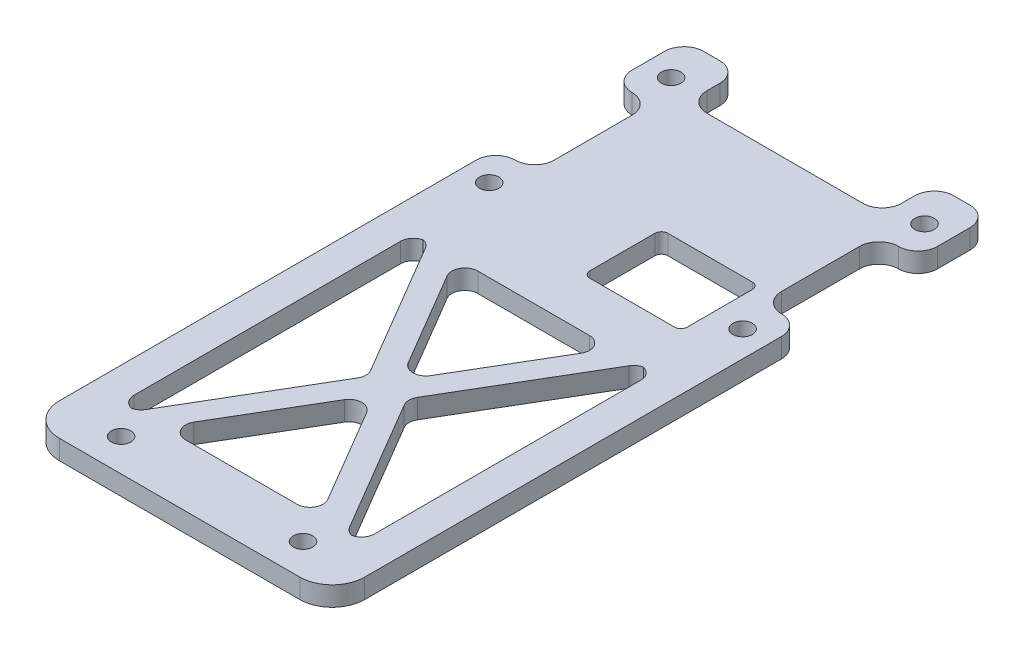
from build123d import *

# Parameters (mm, degrees)
SKETCH_1_W          = 47
SKETCH_1_H          = 40
SKETCH_1_R          = 1.5
SKETCH_1_W_2        = 30
SKETCH_1_H_2        = 12
SKETCH_1_H_3        = 66.16
SKETCH_1_W_3        = 15
EXTRUDE_1_DEPTH     = 3
SKETCH_4_R          = 1.5
SKETCH_4_W          = 47
SKETCH_4_H          = 5
CUT_EXTRUDE_2_DEPTH = 4
SKETCH_7_W          = 30
SKETCH_7_H          = 8
SKETCH_7_W_2        = 6
SKETCH_7_H_2        = 18
CUT_EXTRUDE_3_DEPTH = 10
FILLET_2_R          = 3
FILLET_3_R          = 1
CUT_EXTRUDE_4_DEPTH = 10
FILLET_4_R          = 2
FILLET_5_R          = 5
FILLET_6_R          = 3
FILLET_7_R          = 3


# Some blends are built 0.0001 mm under size
with BuildPart() as part:
    # 草图1 → 凸台-拉伸1 (new body)
    # profile 1 of 3: a face of its own
    with BuildSketch(Plane(origin=(0, 0, 0), x_dir=(1, 0, 0), z_dir=(0, 1, 0))):
        Rectangle(SKETCH_1_W, SKETCH_1_H)
        with Locations(Location((19.5, -14, 0), (0, 0, 270))):
            Circle(SKETCH_1_R, mode=Mode.SUBTRACT)
        with Locations(Location((19.5, 14, 0), (0, 0, 270))):
            Circle(SKETCH_1_R, mode=Mode.SUBTRACT)
        with Locations(Location((-19.5, -14, 0), (0, 0, 270))):
            Circle(SKETCH_1_R, mode=Mode.SUBTRACT)
        with Locations(Location((-19.5, 14, 0), (0, 0, 270))):
            Circle(SKETCH_1_R, mode=Mode.SUBTRACT)
        with Locations((0, -13)):
            Rectangle(SKETCH_1_W_2, SKETCH_1_H_2, mode=Mode.SUBTRACT)
    # profile 2 of 3: a face of its own
    with BuildSketch(Plane(origin=(0, 0, 0), x_dir=(1, 0, 0), z_dir=(0, 1, 0))):
        with Locations((0, -53.08)):
            Rectangle(SKETCH_1_W, SKETCH_1_H_3)
    # profile 3 of 3: a face of its own
    with BuildSketch(Plane(origin=(0, 0, 0), x_dir=(1, 0, 0), z_dir=(0, 1, 0))):
        with Locations((-7.5, -13)):
            Rectangle(SKETCH_1_W_3, SKETCH_1_H_2)
    extrude(amount=EXTRUDE_1_DEPTH)

    # 草图4 → 切除-拉伸2 (cut)
    with BuildSketch(Plane(origin=(0, 3, 0), x_dir=(1, 0, 0), z_dir=(0, 1, 0))):
        with Locations(Location((-14, -76.16, 0), (0, 0, 270))):
            Circle(SKETCH_4_R)
        with Locations(Location((14, -76.16, 0), (0, 0, 270))):
            Circle(SKETCH_4_R)
        with Locations((0, -83.66)):
            Rectangle(SKETCH_4_W, SKETCH_4_H)
    extrude(amount=-CUT_EXTRUDE_2_DEPTH, mode=Mode.SUBTRACT)

    # 草图7 → 切除-拉伸3 (cut)
    with BuildSketch(Plane(origin=(0, 3, 0), x_dir=(1, 0, 0), z_dir=(0, 1, 0))):
        with Locations((0, 16)):
            Rectangle(SKETCH_7_W, SKETCH_7_H)
        with Locations((20.5, 0)):
            Rectangle(SKETCH_7_W_2, SKETCH_7_H_2)
        with Locations((-20.5, 0)):
            Rectangle(SKETCH_7_W_2, SKETCH_7_H_2)
    extrude(amount=-CUT_EXTRUDE_3_DEPTH, mode=Mode.SUBTRACT)

    # 圆角2
    fillet_2_edges = [part.edges().sort_by_distance(p)[0] for p in [
        (-23.5, 1.5, -20),
        (23.5, 1.5, -20),
    ]]
    fillet(fillet_2_edges, radius=FILLET_2_R)

    # 圆角3
    fillet_3_edges = [part.edges().sort_by_distance(p)[0] for p in [
        (0, 1.5, 19),
        (15, 1.5, 19),
        (15, 1.5, 7),
        (0, 1.5, 7),
    ]]
    fillet(fillet_3_edges, radius=FILLET_3_R)

    # 草图9 → 切除-拉伸4 (cut)
    with BuildSketch(Plane(origin=(0, 3, 0), x_dir=(1, 0, 0), z_dir=(0, 1, 0))):
        Polygon((-3, -49.16), (-16.258928571, -26.66), (-18.5, -26.66), (-18.5, -71.66), (-16.258928571, -71.66), align=None)
        Polygon((0, -47.16), (12.080357143, -26.66), (-12.080357143, -26.66), align=None)
        Polygon((18.5, -26.66), (16.258928571, -26.66), (3, -49.16), (16.258928571, -71.66), (18.5, -71.66), align=None)
        Polygon((-12.080357143, -71.66), (12.080357143, -71.66), (0, -51.16), align=None)
    extrude(amount=-CUT_EXTRUDE_4_DEPTH, mode=Mode.SUBTRACT)

    # 圆角4
    # the kernel refuses this fillet: 2 mm, written as the material it adds along each edge
    with BuildSketch(Plane(origin=(16.258928571, 3, 71.66), x_dir=(-0.5076923076923154, 0, -0.8615384615384569), z_dir=(0, -1, 0)), Plane(origin=(16.258928571, 3, 26.66), x_dir=(1, 0, 0), z_dir=(0, -1, 0)), Plane(origin=(-16.258928571, 3, 71.66), x_dir=(-1, 0, 0), z_dir=(0, -1, 0)), Plane(origin=(-16.258928571, 3, 26.66), x_dir=(0.5076923076923154, 0, 0.8615384615384569), z_dir=(0, -1, 0))) as fillet_4_piece_1:
        with BuildLine():
            CenterArc((FILLET_4_R * 0.571428571429, FILLET_4_R), FILLET_4_R, 210.510237406, 59.489762594)
            Line((-FILLET_4_R * 0.29010989011, FILLET_4_R * 0.492307692308), (0, 0))
            Line((0, 0), (FILLET_4_R * 0.571428571429, 0))
        make_face()
    extrude(amount=3)
    with BuildSketch(Plane(origin=(3, 3, 49.16), x_dir=(0.5076923076923108, 0, -0.8615384615384596), z_dir=(0, -1, 0))) as fillet_4_piece_2:
        with BuildLine():
            CenterArc((FILLET_4_R * 0.589285714286, FILLET_4_R), FILLET_4_R, 208.979525188, 61.020474812)
            Line((-FILLET_4_R * 0.285507185123, FILLET_4_R * 0.51550295858), (0, 0))
            Line((0, 0), (FILLET_4_R * 0.589285714286, 0))
        make_face()
    extrude(amount=3)
    with BuildSketch(Plane(origin=(18.5, 3, 26.66), x_dir=(-1, 0, 0), z_dir=(0, -1, 0))) as fillet_4_piece_3:
        with BuildLine():
            CenterArc((FILLET_4_R, -FILLET_4_R), FILLET_4_R, 90, 90)
            Line((0, -FILLET_4_R), (0, 0))
            Line((0, 0), (FILLET_4_R, 0))
        make_face()
    extrude(amount=3)
    with BuildSketch(Plane(origin=(18.5, 3, 71.66), x_dir=(-1, 0, 0), z_dir=(0, -1, 0)), Plane(origin=(-18.5, 3, 71.66), x_dir=(0, 0, -1), z_dir=(0, -1, 0)), Plane(origin=(-18.5, 3, 26.66), x_dir=(1, 0, 0), z_dir=(0, -1, 0))) as fillet_4_piece_4:
        with BuildLine():
            CenterArc((FILLET_4_R, FILLET_4_R), FILLET_4_R, 180, 90)
            Line((0, FILLET_4_R), (0, 0))
            Line((0, 0), (FILLET_4_R, 0))
        make_face()
    extrude(amount=3)
    with BuildSketch(Plane(origin=(-12.080357143, 3, 26.66), x_dir=(0.5076923076923134, 0, 0.8615384615384581), z_dir=(0, -1, 0)), Plane(origin=(-12.080357143, 3, 71.66), x_dir=(1, 0, 0), z_dir=(0, -1, 0))) as fillet_4_piece_5:
        with BuildLine():
            CenterArc((FILLET_4_R * 1.75, -FILLET_4_R), FILLET_4_R, 90, 120.510237406)
            Line((FILLET_4_R * 0.888461538462, -FILLET_4_R * 1.50769230769), (0, 0))
            Line((0, 0), (FILLET_4_R * 1.75, 0))
        make_face()
    extrude(amount=3)
    with BuildSketch(Plane(origin=(12.080357143, 3, 26.66), x_dir=(-0.5076923076923134, 0, 0.8615384615384581), z_dir=(0, -1, 0)), Plane(origin=(12.080357143, 3, 71.66), x_dir=(-1, 0, 0), z_dir=(0, -1, 0))) as fillet_4_piece_6:
        with BuildLine():
            CenterArc((FILLET_4_R * 1.75, FILLET_4_R), FILLET_4_R, 149.489762594, 120.510237406)
            Line((FILLET_4_R * 0.888461538462, FILLET_4_R * 1.50769230769), (0, 0))
            Line((0, 0), (FILLET_4_R * 1.75, 0))
        make_face()
    extrude(amount=3)
    with BuildSketch(Plane(origin=(0, 3, 47.16), x_dir=(-0.5076923076923119, 0, -0.8615384615384591), z_dir=(0, -1, 0)), Plane(origin=(0, 3, 51.16), x_dir=(0.5076923076923116, 0, 0.8615384615384594), z_dir=(0, -1, 0))) as fillet_4_piece_7:
        with BuildLine():
            CenterArc((FILLET_4_R * 1.69696969697, FILLET_4_R), FILLET_4_R, 151.020474812, 118.979525188)
            Line((FILLET_4_R * 0.822176797561, FILLET_4_R * 1.48449704142), (0, 0))
            Line((0, 0), (FILLET_4_R * 1.69696969697, 0))
        make_face()
    extrude(amount=3)
    with BuildSketch(Plane(origin=(-3, 3, 49.16), x_dir=(-0.507692307692313, 0, -0.8615384615384584), z_dir=(0, -1, 0))) as fillet_4_piece_8:
        with BuildLine():
            CenterArc((FILLET_4_R * 0.589285714286, -FILLET_4_R), FILLET_4_R, 90, 61.020474812)
            Line((-FILLET_4_R * 0.285507185123, -FILLET_4_R * 0.51550295858), (0, 0))
            Line((0, 0), (FILLET_4_R * 0.589285714286, 0))
        make_face()
    extrude(amount=3)

    # 圆角5
    fillet_5_edges = [part.edges().sort_by_distance(p)[0] for p in [
        (-23.5, 1.5, 81.16),
        (23.5, 1.5, 81.16),
    ]]
    fillet(fillet_5_edges, radius=FILLET_5_R)

    # 圆角6
    fillet_6_edges = [part.edges().sort_by_distance(p)[0] for p in [
        (15, 1.5, -20),
        (15, 1.5, -12),
        (-15, 1.5, -12),
        (-15, 1.5, -20),
        (17.5, 1.5, -9),
        (17.5, 1.5, 9),
        (-17.5, 1.5, 9),
        (-17.5, 1.5, -9),
    ]]
    fillet(fillet_6_edges, radius=FILLET_6_R)

    # 圆角7
    fillet_7_edges = [part.edges().sort_by_distance(p)[0] for p in [
        (23.5, 1.5, -9),
        (23.5, 1.5, 9),
        (-23.5, 1.5, 9),
        (-23.5, 1.5, -9),
    ]]
    fillet(fillet_7_edges, radius=FILLET_7_R - 0.0001)  # a hair under: the kernel refuses the full size


solid = part.part
